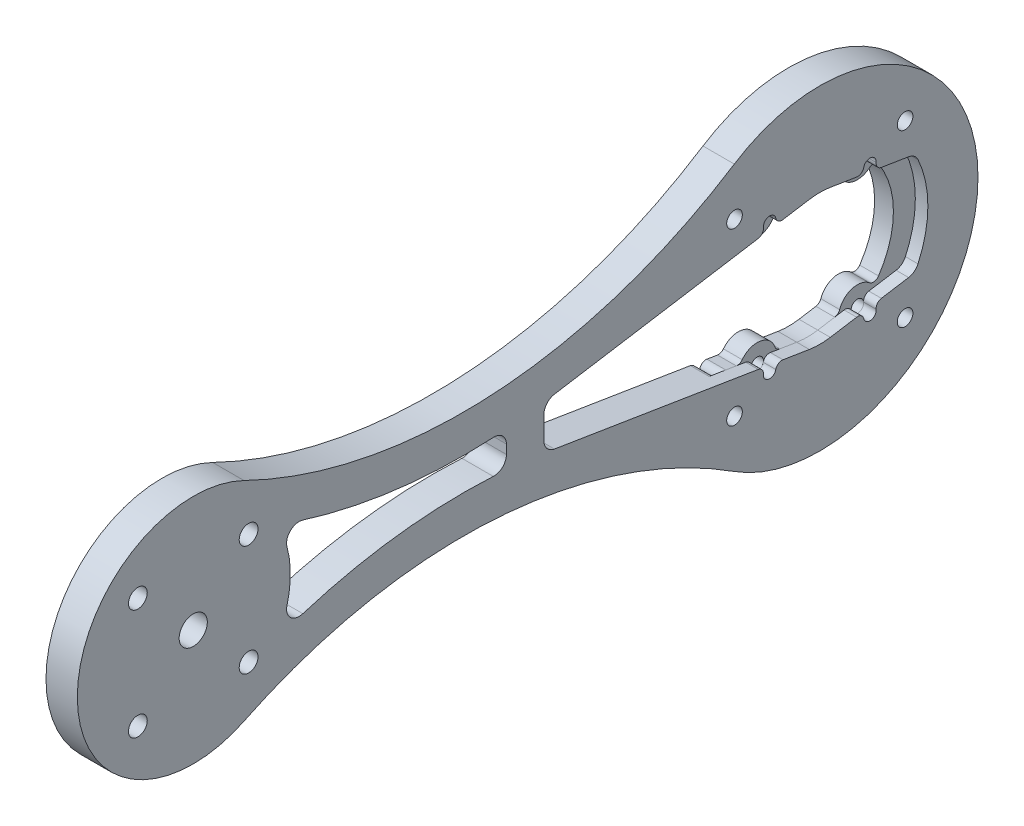
from build123d import *

# Parameters (mm, degrees)
SKETCH_1_R              = 1.25
SKETCH_1_R_2            = 1.5
SKETCH_1_R_3            = 2.25
SKETCH_1_R_4            = 10.5
EXTRUDE_1_DEPTH         = 5
CUT_EXTRUDE_START       = -10
CUT_EXTRUDE_1_DEPTH     = 10
FILLET_1_R              = 2
SKETCH_3_R              = 1
CUT_EXTRUDE_2_DEPTH     = 10
FILLET_2_R              = 1
CUT_EXTRUDE_4_DEPTH     = 3
EXTRUDE_2_DEPTH         = 3
CUT_EXTRUDE_START_2     = -3
CUT_EXTRUDE_5_OUTLINE_R = 1
CUT_EXTRUDE_5_DEPTH     = 3
FILLET_3_R              = 1
FILLET_4_R              = 1


with BuildPart() as part:
    # 草图1 → 凸台-拉伸1 (new body)
    with BuildSketch(Plane(origin=(0, 0, 0), x_dir=(0, 0, -1), z_dir=(1, 0, 0))):
        with BuildLine():
            ThreePointArc((-13.644971051, -21.245641083), (25.25, 0), (-13.644971051, 21.245641083))
            ThreePointArc((-13.644971051, 21.245641083), (-52.169100828, 8.697184645), (-91.900674175, 16.632826614))
            ThreePointArc((-91.900674175, 16.632826614), (-118.5, 0), (-91.900674175, -16.632826614))
            ThreePointArc((-91.900674175, -16.632826614), (-52.169100828, -8.697184645), (-13.644971051, -21.245641083))
        make_face()
        with Locations((13.611805538, 13.611805538)):
            Circle(SKETCH_1_R, mode=Mode.SUBTRACT)
        with Locations((-108.838834765, 8.838834765)):
            Circle(SKETCH_1_R_2, mode=Mode.SUBTRACT)
        with Locations((13.611805538, -13.611805538)):
            Circle(SKETCH_1_R, mode=Mode.SUBTRACT)
        with Locations((-13.611805538, -13.611805538)):
            Circle(SKETCH_1_R, mode=Mode.SUBTRACT)
        with Locations((-13.611805538, 13.611805538)):
            Circle(SKETCH_1_R, mode=Mode.SUBTRACT)
        with Locations((-91.161165235, 8.838834765)):
            Circle(SKETCH_1_R_2, mode=Mode.SUBTRACT)
        with Locations((-91.161165235, -8.838834765)):
            Circle(SKETCH_1_R_2, mode=Mode.SUBTRACT)
        with Locations((-108.838834765, -8.838834765)):
            Circle(SKETCH_1_R_2, mode=Mode.SUBTRACT)
        with Locations((-100, 0)):
            Circle(SKETCH_1_R_3, mode=Mode.SUBTRACT)
        Circle(SKETCH_1_R_4, mode=Mode.SUBTRACT)
    extrude(amount=EXTRUDE_1_DEPTH)

    # 草图2 → 切除-拉伸1 (cut)
    with BuildSketch(Plane(origin=(5, 0, 0), x_dir=(0, 0, -1), z_dir=(1, 0, 0)).offset(CUT_EXTRUDE_START)):
        with BuildLine():
            Line((-1.675578367, 10.365444377), (-43.152777776, 3.660637951))
            ThreePointArc((-43.152777776, 3.660637951), (-43.631277256, 3.584670753), (-44.110197111, 3.51140044))
            ThreePointArc((-44.110197111, 3.51140044), (-44, 0), (-44.110197111, -3.51140044))
            ThreePointArc((-44.110197111, -3.51140044), (-43.631277256, -3.584670753), (-43.152777776, -3.660637951))
            Line((-43.152777776, -3.660637951), (-1.675578367, -10.365444377))
            ThreePointArc((-1.675578367, -10.365444377), (-10.5, 0), (-1.675578367, 10.365444377))
        make_face()
        with BuildLine():
            ThreePointArc((-50.080014318, -2.827548326), (-50, 0), (-50.080014318, 2.827548326))
            ThreePointArc((-50.080014318, 2.827548326), (-68.639565024, 3.366827977), (-86.650810078, 7.877126915))
            ThreePointArc((-86.650810078, 7.877126915), (-84.5, 0), (-86.650810078, -7.877126915))
            ThreePointArc((-86.650810078, -7.877126915), (-68.639565024, -3.366827977), (-50.080014318, -2.827548326))
        make_face()
        with BuildLine():
            Line((1.675578367, -10.365444377), (15.186407653, -8.181413239))
            ThreePointArc((15.186407653, -8.181413239), (17.25, 0), (15.186407653, 8.181413239))
            Line((15.186407653, 8.181413239), (1.675578367, 10.365444377))
            ThreePointArc((1.675578367, 10.365444377), (10.5, 0), (1.675578367, -10.365444377))
        make_face()
    extrude(amount=CUT_EXTRUDE_1_DEPTH, mode=Mode.SUBTRACT)

    # 圆角1
    fillet_1_edges = [part.edges().sort_by_distance(p)[0] for p in [
        (2.5, -7.877126915, 86.650810078),
        (2.5, 8.181413239, -15.186407653),
        (2.5, -8.181413239, -15.186407653),
        (2.5, 7.877126915, 86.650810078),
        (2.5, 2.827548326, 50.080014318),
        (2.5, -2.827548326, 50.080014318),
        (2.5, 3.51140044, 44.110197111),
        (2.5, -3.51140044, 44.110197111),
    ]]
    fillet(fillet_1_edges, radius=FILLET_1_R)

    # 草图3 → 切除-拉伸2 (cut)
    with BuildSketch(Plane(origin=(5, 0, 0), x_dir=(0, 0, -1), z_dir=(1, 0, 0))):
        with Locations((-8, 10.25)):
            Circle(SKETCH_3_R)
        with Locations((-8, -10.25)):
            Circle(SKETCH_3_R)
        with Locations((8, -10.25)):
            Circle(SKETCH_3_R)
        with Locations((8, 10.25)):
            Circle(SKETCH_3_R)
    extrude(amount=-CUT_EXTRUDE_2_DEPTH, mode=Mode.SUBTRACT)

    # 圆角2
    fillet_2_edges = [part.edges().sort_by_distance(p)[0] for p in [
        (2.5, 9.295100355, -8.296928726),
        (2.5, 9.437286892, -7.417335942),
        (2.5, -9.295100355, -8.296928726),
        (2.5, -9.437286892, -7.417335942),
        (2.5, -9.295100355, 8.296928726),
        (2.5, -9.437286892, 7.417335942),
        (2.5, 9.295100355, 8.296928726),
        (2.5, 9.437286892, 7.417335942),
    ]]
    fillet(fillet_2_edges, radius=FILLET_2_R)

    # 草图4 → 切除-拉伸4 (cut)
    with BuildSketch(Plane(origin=(0, 0, 0), x_dir=(0, 0, -1), z_dir=(1, 0, 0))):
        with BuildLine():
            ThreePointArc((-6.363223316, 16.033461542), (-17.25, 0), (-6.363223316, -16.033461542))
            ThreePointArc((-6.363223316, -16.033461542), (-4.982266618, -18.594072156), (-2.50601773, -17.066996664))
            ThreePointArc((-2.50601773, -17.066996664), (0, -17.25), (2.50601773, -17.066996664))
            ThreePointArc((2.50601773, -17.066996664), (4.982266618, -18.594072156), (6.363223316, -16.033461542))
            ThreePointArc((6.363223316, -16.033461542), (17.25, 0), (6.363223316, 16.033461542))
            ThreePointArc((6.363223316, 16.033461542), (4.982266618, 18.594072156), (2.50601773, 17.066996664))
            ThreePointArc((2.50601773, 17.066996664), (0, 17.25), (-2.50601773, 17.066996664))
            ThreePointArc((-2.50601773, 17.066996664), (-4.982266618, 18.594072156), (-6.363223316, 16.033461542))
        make_face()
    extrude(amount=CUT_EXTRUDE_4_DEPTH, mode=Mode.SUBTRACT)

    # 圆角3
    fillet_3_edges = [part.edges().sort_by_distance(p)[0] for p in [
        (1.5, -8.181413239, 15.186407653),
        (1.5, -16.033461542, -6.363223316),
        (1.5, -17.066996664, -2.50601773),
        (1.5, 16.033461542, -6.363223316),
        (1.5, 17.066996664, -2.50601773),
        (1.5, 17.066996664, 2.50601773),
        (1.5, 8.181413239, 15.186407653),
        (1.5, 16.033461542, 6.363223316),
        (1.5, -16.033461542, 6.363223316),
        (1.5, -17.066996664, 2.50601773),
    ]]
    fillet(fillet_3_edges, radius=FILLET_3_R)


with BuildPart() as body_2:
    # 草图4<2> → 凸台-拉伸2 (new body)
    with BuildSketch(Plane(origin=(0, 0, 0), x_dir=(0, 0, -1), z_dir=(1, 0, 0))):
        with BuildLine():
            ThreePointArc((-6.363223316, 16.033461542), (-17.25, 0), (-6.363223316, -16.033461542))
            ThreePointArc((-6.363223316, -16.033461542), (-4.982266618, -18.594072156), (-2.50601773, -17.066996664))
            ThreePointArc((-2.50601773, -17.066996664), (0, -17.25), (2.50601773, -17.066996664))
            ThreePointArc((2.50601773, -17.066996664), (4.982266618, -18.594072156), (6.363223316, -16.033461542))
            ThreePointArc((6.363223316, -16.033461542), (17.25, 0), (6.363223316, 16.033461542))
            ThreePointArc((6.363223316, 16.033461542), (4.982266618, 18.594072156), (2.50601773, 17.066996664))
            ThreePointArc((2.50601773, 17.066996664), (0, 17.25), (-2.50601773, 17.066996664))
            ThreePointArc((-2.50601773, 17.066996664), (-4.982266618, 18.594072156), (-6.363223316, 16.033461542))
        make_face()
    extrude(amount=EXTRUDE_2_DEPTH)

    # 切除-拉伸5: read off the stored shape, not the designer's step
    # 切除-拉伸5 outline → 切除-拉伸5 (cut)
    with BuildSketch(Plane(origin=(3, 0, 0), x_dir=(0, 0, -1), z_dir=(1, 0, 0)).offset(CUT_EXTRUDE_START_2)):
        with BuildLine():
            Line((-5.030527041, -9.823115537), (-1.675578367, -10.365444377))
            ThreePointArc((-1.675578367, -10.365444377), (0, -10.5), (1.675578367, -10.365444377))
            Line((1.675578367, -10.365444377), (5.030527041, -9.823115537))
            ThreePointArc((5.030527041, -9.823115537), (7.435663826, -7.303557283), (10.601579495, -8.756084296))
            ThreePointArc((10.601579495, -8.756084296), (13.75, 0), (10.601579495, 8.756084296))
            ThreePointArc((10.601579495, 8.756084296), (7.435663826, 7.303557283), (5.030527041, 9.823115537))
            Line((5.030527041, 9.823115537), (1.675578367, 10.365444377))
            ThreePointArc((1.675578367, 10.365444377), (0, 10.5), (-1.675578367, 10.365444377))
            Line((-1.675578367, 10.365444377), (-5.030527041, 9.823115537))
            ThreePointArc((-5.030527041, 9.823115537), (-7.521263324, 7.288444464), (-10.683737627, 8.90927171))
            Line((-10.683737627, 8.90927171), (-15.186407653, 8.181413239))
            ThreePointArc((-15.186407653, 8.181413239), (-17.25, 0), (-15.186407653, -8.181413239))
            Line((-15.186407653, -8.181413239), (-10.683737627, -8.90927171))
            ThreePointArc((-10.683737627, -8.90927171), (-7.521263324, -7.288444464), (-5.030527041, -9.823115537))
        make_face()
        with Locations((-8, -10.25)):
            Circle(CUT_EXTRUDE_5_OUTLINE_R)
        with Locations((8, -10.25)):
            Circle(CUT_EXTRUDE_5_OUTLINE_R)
        with Locations((8, 10.25)):
            Circle(CUT_EXTRUDE_5_OUTLINE_R)
        with Locations((-8, 10.25)):
            Circle(CUT_EXTRUDE_5_OUTLINE_R)
    extrude(amount=CUT_EXTRUDE_5_DEPTH, mode=Mode.SUBTRACT)

    # 圆角4
    fillet_4_edges = [body_2.edges().sort_by_distance(p)[0] for p in [
        (1.5, 17.066996664, -2.50601773),
        (1.5, 16.033461542, -6.363223316),
        (1.5, -16.033461542, -6.363223316),
        (1.5, -17.066996664, -2.50601773),
        (1.5, -17.066996664, 2.50601773),
        (1.5, -16.033461542, 6.363223316),
        (1.5, 16.033461542, 6.363223316),
        (1.5, 17.066996664, 2.50601773),
        (1.5, -9.823115537, 5.030527041),
        (1.5, -8.90927171, 10.683737627),
        (1.5, -8.181413239, 15.186407653),
        (1.5, 8.181413239, 15.186407653),
        (1.5, 8.90927171, 10.683737627),
        (1.5, 9.823115537, 5.030527041),
        (1.5, 9.823115537, -5.030527041),
        (1.5, 8.756084296, -10.601579495),
        (1.5, -8.756084296, -10.601579495),
        (1.5, -9.823115537, -5.030527041),
    ]]
    fillet(fillet_4_edges, radius=FILLET_4_R)


solid = Compound([part.part, body_2.part])
